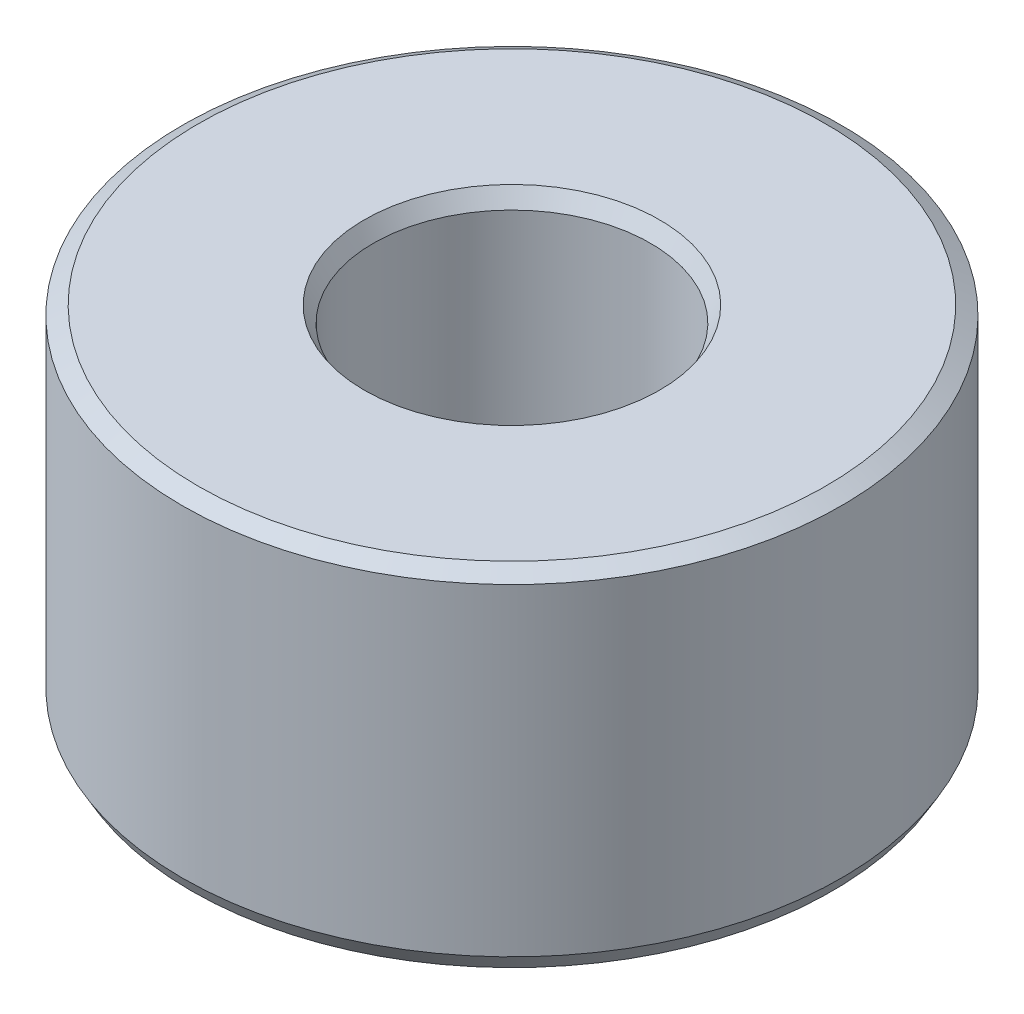
from build123d import *
from OCP.BRepFilletAPI import BRepFilletAPI_MakeChamfer

# Parameters (mm, degrees)
SKETCH1_R           = 55
BOSS_EXTRUDE1_DEPTH = 57.952195802
SKETCH2_R           = 23.124403346
CUT_EXTRUDE1_DEPTH  = 97.997200982
CHAMFER1_SIZE       = 1.517761614
CHAMFER1_SIZE2      = 2.62884023


with BuildPart() as part:
    # Sketch1 → Boss-Extrude1 (new body)
    with BuildSketch(Plane(origin=(0, 0, 0), x_dir=(1, 0, 0), z_dir=(0, 1, 0))):
        Circle(SKETCH1_R)
    extrude(amount=BOSS_EXTRUDE1_DEPTH)

    # Sketch2 → Cut-Extrude1 (cut, through all)
    with BuildSketch(Plane(origin=(0, 0, 0), x_dir=(1, 0, 0), z_dir=(0, 1, 0))):
        Circle(SKETCH2_R)
    extrude(amount=CUT_EXTRUDE1_DEPTH, mode=Mode.SUBTRACT)

    # Chamfer1: one chamfer whose edges measure the first distance from different faces: ONE call of the kernel's chamfer builder (chamfer() names one face for all edges)
    chamfer1_edges_1 = [part.edges().sort_by_distance(p)[0] for p in [
        (-23.124403346, 57.952195802, 0),
    ]]
    chamfer1_side_1 = [part.faces().sort_by_distance(p)[0] for p in [
        (-53.444365081, 57.952195802, 0),
    ]]
    chamfer1_edges_2 = [part.edges().sort_by_distance(p)[0] for p in [
        (-23.124403346, 0, 0),
    ]]
    chamfer1_side_2 = [part.faces().sort_by_distance(p)[0] for p in [
        (-23.124403346, 28.976097901, 0),
    ]]
    chamfer1_edges_3 = [part.edges().sort_by_distance(p)[0] for p in [
        (-55, 0, 0),
    ]]
    chamfer1_side_3 = [part.faces().sort_by_distance(p)[0] for p in [
        (-53.444365081, 0, 0),
    ]]
    chamfer1_edges_4 = [part.edges().sort_by_distance(p)[0] for p in [
        (-55, 57.952195802, 0),
    ]]
    chamfer1_side_4 = [part.faces().sort_by_distance(p)[0] for p in [
        (-55, 28.976097901, 0),
    ]]
    chamfer1 = BRepFilletAPI_MakeChamfer(part.part.solid().wrapped)
    for e in chamfer1_edges_1:
        chamfer1.Add(CHAMFER1_SIZE, CHAMFER1_SIZE2, e.wrapped, chamfer1_side_1[0].wrapped)  # the first distance lies on this face
    for e in chamfer1_edges_2:
        chamfer1.Add(CHAMFER1_SIZE, CHAMFER1_SIZE2, e.wrapped, chamfer1_side_2[0].wrapped)  # the first distance lies on this face
    for e in chamfer1_edges_3:
        chamfer1.Add(CHAMFER1_SIZE, CHAMFER1_SIZE2, e.wrapped, chamfer1_side_3[0].wrapped)  # the first distance lies on this face
    for e in chamfer1_edges_4:
        chamfer1.Add(CHAMFER1_SIZE, CHAMFER1_SIZE2, e.wrapped, chamfer1_side_4[0].wrapped)  # the first distance lies on this face
    add(Compound.cast(chamfer1.Shape()), mode=Mode.REPLACE)


solid = part.part
